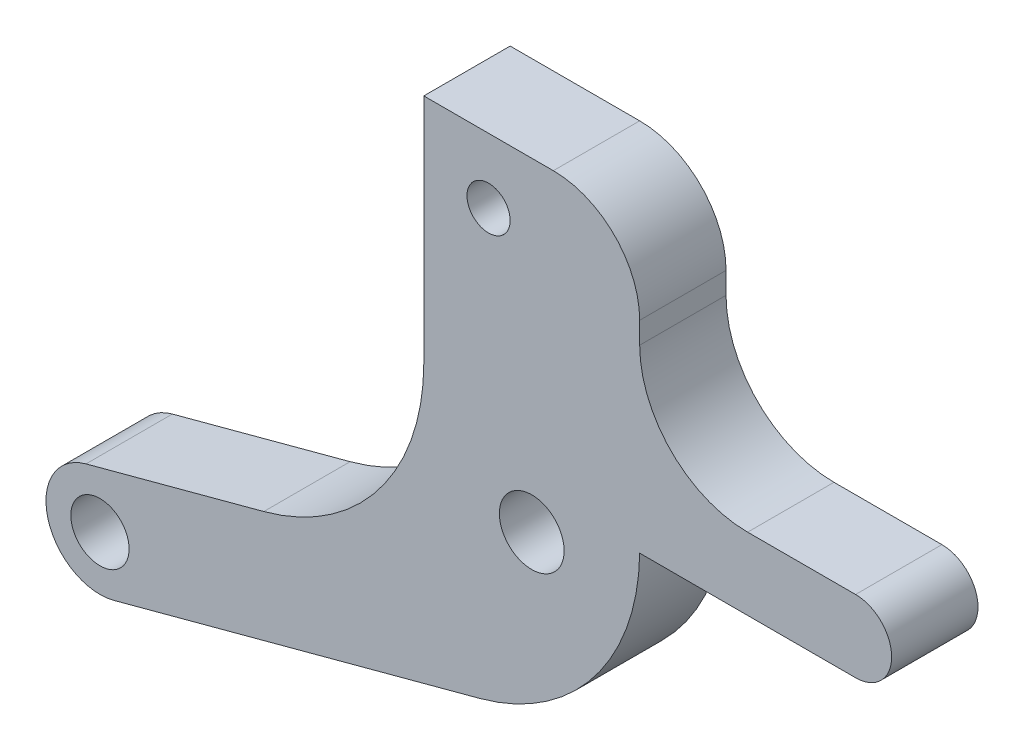
from build123d import *

# Parameters (mm, degrees)
SKETCH1_R           = 1.5
SKETCH1_R_2         = 1
SKETCH1_R_3         = 1.35
BOSS_EXTRUDE1_DEPTH = 4
FILLET1_R           = 10
FILLET2_R           = 10
FILLET3_R           = 5
FILLET4_R           = 4


with BuildPart() as part:
    # Sketch1 → Boss-Extrude1 (new body)
    with BuildSketch(Plane.XY):
        with BuildLine():
            Line((15, 5), (5, 5))
            Line((5, 5), (5, 15))
            Line((5, 15), (-5, 15))
            Line((-5, 15), (-5, -3.392571663))
            Line((-5, -3.392571663), (-20.647047613, -7.585185434))
            ThreePointArc((-20.647047613, -7.585185434), (-22.414814566, -10.647047613), (-19.352952387, -12.414814566))
            Line((-19.352952387, -12.414814566), (5, -5.88946064))
            Line((5, -5.88946064), (5, 1.658780206))
            Line((5, 1.658780206), (15, 1.658780206))
            ThreePointArc((15, 1.658780206), (16.670609897, 3.329390103), (15, 5))
        make_face()
        Circle(SKETCH1_R, mode=Mode.SUBTRACT)
        with Locations((-2, 12)):
            Circle(SKETCH1_R_2, mode=Mode.SUBTRACT)
        with Locations((-20, -10)):
            Circle(SKETCH1_R_3, mode=Mode.SUBTRACT)
    extrude(amount=BOSS_EXTRUDE1_DEPTH)

    # Fillet1
    # the kernel refuses this fillet: 10 mm, written as the material it takes off along each edge
    with BuildSketch(Plane(origin=(5, -5.88946064, -19.183174699), x_dir=(-0.965925826289069, -0.2588190451025183, 0), z_dir=(0, 0, 1))) as fillet1_piece_1_section:
        with BuildLine():
            CenterArc((FILLET1_R * 0.767326987979, -FILLET1_R), FILLET1_R, 90, 75)
            Line((-FILLET1_R * 0.19859883831, -FILLET1_R * 0.741180954897), (0, 0))
            Line((0, 0), (FILLET1_R * 0.767326987979, 0))
        make_face()
    fillet1_piece_1 = extrude(amount=42.366349399, mode=Mode.PRIVATE)
    fillet1_piece_1 = split(fillet1_piece_1, bisect_by=Plane(origin=(3.36090957, 1.658780206, 2), z_dir=(0, -1, 0)), keep=Keep.TOP, mode=Mode.PRIVATE)
    add(fillet1_piece_1, mode=Mode.SUBTRACT)

    # Fillet2
    fillet2_edges = [part.edges().sort_by_distance(p)[0] for p in [
        (-5, -3.392571663, 2),
    ]]
    fillet(fillet2_edges, radius=FILLET2_R)

    # Fillet3
    fillet3_edges = [part.edges().sort_by_distance(p)[0] for p in [
        (5, 5, 2),
    ]]
    fillet(fillet3_edges, radius=FILLET3_R)

    # Fillet4
    fillet4_edges = [part.edges().sort_by_distance(p)[0] for p in [
        (5, 15, 2),
    ]]
    fillet(fillet4_edges, radius=FILLET4_R)


solid = part.part
